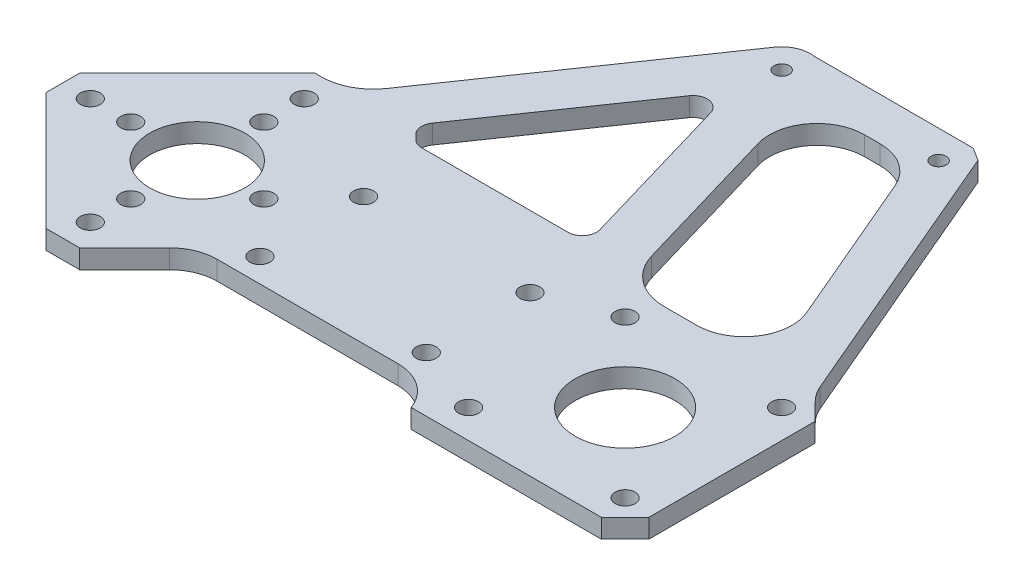
from build123d import *

# Parameters (mm, degrees)
SKETCH_1_R          = 2.1
SKETCH_1_R_2        = 10.5
SKETCH_1_R_3        = 10
EXTRUDE_1_DEPTH     = 4
CHAMFER_1_SIZE      = 5
FILLET_1_R          = 10
SKETCH_2_R          = 2.1
CUT_EXTRUDE_1_DEPTH = 10
EXTRUDE_START       = -4
SKETCH_3_R          = 1.6
EXTRUDE_2_DEPTH     = 4
FILLET_2_R          = 3
FILLET_3_R          = 11
SKETCH_4_R          = 1.6
EXTRUDE_3_DEPTH     = 4
FILLET_4_R          = 10
CHAMFER_2_SIZE      = 2
CHAMFER_2_SIZE2     = 1.851556395
FILLET_5_R          = 10


with BuildPart() as part:
    # 草图1 → 凸台-拉伸1 (new body)
    with BuildSketch(Plane(origin=(0, 0, 0), x_dir=(1, 0, 0), z_dir=(0, 1, 0))):
        Polygon((0, 31.819805153), (-31.819805153, 0), (0, -31.819805153), (15.909902577, -15.909902577), (67.5, -15.909902577), (67.5, -22.5), (112.5, -22.5), (112.5, 22.5), (67.5, 22.5), (67.5, 15.909902577), (15.909902577, 15.909902577), align=None)
        with Locations(Location((0, 14, 0), (0, 0, 270))):
            Circle(SKETCH_1_R, mode=Mode.SUBTRACT)
        with Locations(Location((14, 0, 0), (0, 0, 270))):
            Circle(SKETCH_1_R, mode=Mode.SUBTRACT)
        with Locations(Location((0, -14, 0), (0, 0, 270))):
            Circle(SKETCH_1_R, mode=Mode.SUBTRACT)
        with Locations(Location((-14, 0, 0), (0, 0, 270))):
            Circle(SKETCH_1_R, mode=Mode.SUBTRACT)
        with Locations(Location((90, 0, 0), (0, 0, 270))):
            Circle(SKETCH_1_R_2, mode=Mode.SUBTRACT)
        with Locations(Location((0, 22.5, 0), (0, 0, 270))):
            Circle(SKETCH_1_R, mode=Mode.SUBTRACT)
        with Locations(Location((0, -22.5, 0), (0, 0, 270))):
            Circle(SKETCH_1_R, mode=Mode.SUBTRACT)
        with Locations(Location((0, 0, 0), (0, 0, 270))):
            Circle(SKETCH_1_R_3, mode=Mode.SUBTRACT)
        with Locations(Location((-22.5, 0, 0), (0, 0, 270))):
            Circle(SKETCH_1_R, mode=Mode.SUBTRACT)
    extrude(amount=EXTRUDE_1_DEPTH)

    # 倒角1
    chamfer_1_edges = [part.edges().sort_by_distance(p)[0] for p in [
        (112.5, 2, -22.5),
        (112.5, 2, 22.5),
        (0, 2, 31.819805153),
        (-31.819805153, 2, 0),
        (0, 2, -31.819805153),
    ]]
    chamfer(chamfer_1_edges, length=CHAMFER_1_SIZE)

    # 圆角1
    # the kernel refuses this fillet: 10 mm, written as the material it adds along each edge
    with BuildSketch(Plane(origin=(15.909902577, 0, -15.909902577), x_dir=(-0.707106781186552, 0, -0.707106781186543), z_dir=(0, 1, 0))) as fillet_1_piece_1:
        with BuildLine():
            CenterArc((FILLET_1_R * 0.414213562373, -FILLET_1_R), FILLET_1_R, 90, 45)
            Line((-FILLET_1_R * 0.292893218813, -FILLET_1_R * 0.292893218813), (-FILLET_1_R * 0.307035354437, -FILLET_1_R * 0.27875108319))
            Line((-FILLET_1_R * 0.307035354437, -FILLET_1_R * 0.27875108319), (-FILLET_1_R * 0.00828427124746, FILLET_1_R * 0.02))
            Line((-FILLET_1_R * 0.00828427124746, FILLET_1_R * 0.02), (FILLET_1_R * 0.414213562373, FILLET_1_R * 0.02))
            Line((FILLET_1_R * 0.414213562373, FILLET_1_R * 0.02), (FILLET_1_R * 0.414213562373, 0))
        make_face()
    extrude(amount=4)
    with BuildSketch(Plane(origin=(15.909902577, 0, 15.909902577), x_dir=(-0.7071067811865422, 0, 0.707106781186553), z_dir=(0, 1, 0))) as fillet_1_piece_2:
        with BuildLine():
            CenterArc((FILLET_1_R * 0.414213562373, FILLET_1_R), FILLET_1_R, 225, 45)
            Line((-FILLET_1_R * 0.292893218813, FILLET_1_R * 0.292893218813), (-FILLET_1_R * 0.307035354437, FILLET_1_R * 0.27875108319))
            Line((-FILLET_1_R * 0.307035354437, FILLET_1_R * 0.27875108319), (-FILLET_1_R * 0.00828427124746, -FILLET_1_R * 0.02))
            Line((-FILLET_1_R * 0.00828427124746, -FILLET_1_R * 0.02), (FILLET_1_R * 0.414213562373, -FILLET_1_R * 0.02))
            Line((FILLET_1_R * 0.414213562373, -FILLET_1_R * 0.02), (FILLET_1_R * 0.414213562373, 0))
        make_face()
    extrude(amount=4)
    with BuildSketch(Plane(origin=(67.5, 0, 15.909902577), x_dir=(-1, 0, 0), z_dir=(0, 1, 0))) as fillet_1_piece_3:
        with BuildLine():
            CenterArc((9.400668296, 10), FILLET_1_R, 199.937217397, 70.062782603)
            Line((0, 6.590097423), (-0.188013366, 6.521899372))
            ThreePointArc((-0.188013366, 6.521899372), (-0.2, 3.295048712), (-0.2, 0))
            Line((-0.2, 0), (0, -0.2))
            Line((0, -0.2), (9.400668296, -0.2))
            Line((9.400668296, -0.2), (9.400668296, 0))
        make_face()
    extrude(amount=4)
    with BuildSketch(Plane(origin=(67.5, 0, -15.909902577), x_dir=(-1, 0, 0), z_dir=(0, 1, 0))) as fillet_1_piece_4:
        with BuildLine():
            CenterArc((9.400668296, -10), FILLET_1_R, 90, 70.062782603)
            Line((0, -6.590097423), (-0.188013366, -6.521899372))
            ThreePointArc((-0.188013366, -6.521899372), (-0.2, -3.295048712), (-0.2, 0))
            Line((-0.2, 0), (0, 0.2))
            Line((0, 0.2), (9.400668296, 0.2))
            Line((9.400668296, 0.2), (9.400668296, 0))
        make_face()
    extrude(amount=4)

    # 草图2 → 切除-拉伸1 (cut)
    with BuildSketch(Plane.XZ):
        with Locations(Location((106.464466094, 16.464466094, 0), (0, 0, 270))):
            Circle(SKETCH_2_R)
        with Locations(Location((106.464466094, -16.464466094, 0), (0, 0, 270))):
            Circle(SKETCH_2_R)
        with Locations(Location((73.535533906, -16.464466094, 0), (0, 0, 90))):
            Circle(SKETCH_2_R)
        with Locations(Location((73.535533906, 16.464466094, 0), (0, 0, 90))):
            Circle(SKETCH_2_R)
        with Locations(Location((24.075684952, 10.909902577, 0), (0, 0, 270))):
            Circle(SKETCH_2_R)
        with Locations(Location((59.075684952, 10.909902577, 0), (0, 0, 270))):
            Circle(SKETCH_2_R)
        with Locations(Location((59.075684952, -10.909902577, 0), (0, 0, 90))):
            Circle(SKETCH_2_R)
        with Locations(Location((24.075684952, -10.909902577, 0), (0, 0, 90))):
            Circle(SKETCH_2_R)
    extrude(amount=-CUT_EXTRUDE_1_DEPTH, mode=Mode.SUBTRACT)

    # 草图3 → 凸台-拉伸2 (add)
    with BuildSketch(Plane(origin=(0, 4, 0), x_dir=(1, 0, 0), z_dir=(0, 1, 0)).offset(EXTRUDE_START)):
        with BuildLine():
            Line((3.535533906, 28.284271247), (40.057636417, 81.344203773))
            ThreePointArc((40.057636417, 81.344203773), (45.94930127, 83.86671265), (50.75784592, 79.629654221))
            Line((50.75784592, 79.629654221), (67.5, 22.5))
            ThreePointArc((67.5, 22.5), (63.839583189, 17.721525883), (58.099331704, 15.909902577))
            Line((58.099331704, 15.909902577), (20.0520382, 15.909902577))
            ThreePointArc((20.0520382, 15.909902577), (16.225203877, 16.671107252), (12.980970389, 18.838834765))
            Line((12.980970389, 18.838834765), (3.535533906, 28.284271247))
        make_face()
        with Locations(Location((45, 77.942286341, 0), (0, 0, 270))):
            Circle(SKETCH_3_R, mode=Mode.SUBTRACT)
        Polygon((16.491758356, 29.470182421), (43.526560522, 68.746803428), (56.080145943, 25.909902577), (20.0520382, 25.909902577), align=None, mode=Mode.SUBTRACT)
    extrude(amount=EXTRUDE_2_DEPTH)

    # 圆角2
    fillet_2_edges = [part.edges().sort_by_distance(p)[0] for p in [
        (16.491758356, 2, -29.470182421),
        (43.526560522, 2, -68.746803428),
        (56.080145943, 2, -25.909902577),
        (20.0520382, 2, -25.909902577),
    ]]
    fillet(fillet_2_edges, radius=FILLET_2_R)

    # 圆角3
    fillet_3_edges = [part.edges().sort_by_distance(p)[0] for p in [
        (67.5, 2, -22.5),
        (3.535533906, 2, -28.284271247),
    ]]
    fillet(fillet_3_edges, radius=FILLET_3_R)

    # 草图4 → 凸台-拉伸3 (add)
    with BuildSketch(Plane(origin=(0, 4, 0), x_dir=(1, 0, 0), z_dir=(0, 1, 0)).offset(EXTRUDE_START)):
        with BuildLine():
            Line((45.94930127, 83.86671265), (81.347717681, 83.86671265))
            Line((81.347717681, 83.86671265), (107.5, 22.5))
            Line((107.5, 22.5), (97.716806526, 22.5))
            Line((97.716806526, 22.5), (75.4, 74.86671265))
            Line((75.4, 74.86671265), (52.153651701, 74.86671265))
            Line((52.153651701, 74.86671265), (50.75784592, 79.629654221))
            ThreePointArc((50.75784592, 79.629654221), (48.966689034, 82.443994695), (45.94930127, 83.86671265))
        make_face()
        with Locations(Location((78, 77.942286341, 0), (0, 0, 270))):
            Circle(SKETCH_4_R, mode=Mode.SUBTRACT)
    extrude(amount=EXTRUDE_3_DEPTH)

    # 圆角4
    fillet_4_edges = [part.edges().sort_by_distance(p)[0] for p in [
        (97.716806526, 2, -22.5),
        (75.4, 2, -74.86671265),
        (52.153651701, 2, -74.86671265),
    ]]
    fillet(fillet_4_edges, radius=FILLET_4_R)

    # 倒角2
    chamfer_2_edges = [part.edges().sort_by_distance(p)[0] for p in [
        (81.347717681, 2, -83.86671265),
    ]]
    chamfer_2_side = [part.faces().sort_by_distance(p)[0] for p in [
        (63.648509476, 2, -83.86671265),
    ]]
    chamfer(chamfer_2_edges, length=CHAMFER_2_SIZE, length2=CHAMFER_2_SIZE2, reference=chamfer_2_side[0])

    # 圆角5
    fillet_5_edges = [part.edges().sort_by_distance(p)[0] for p in [
        (107.5, 2, -22.5),
    ]]
    fillet(fillet_5_edges, radius=FILLET_5_R)


solid = part.part
